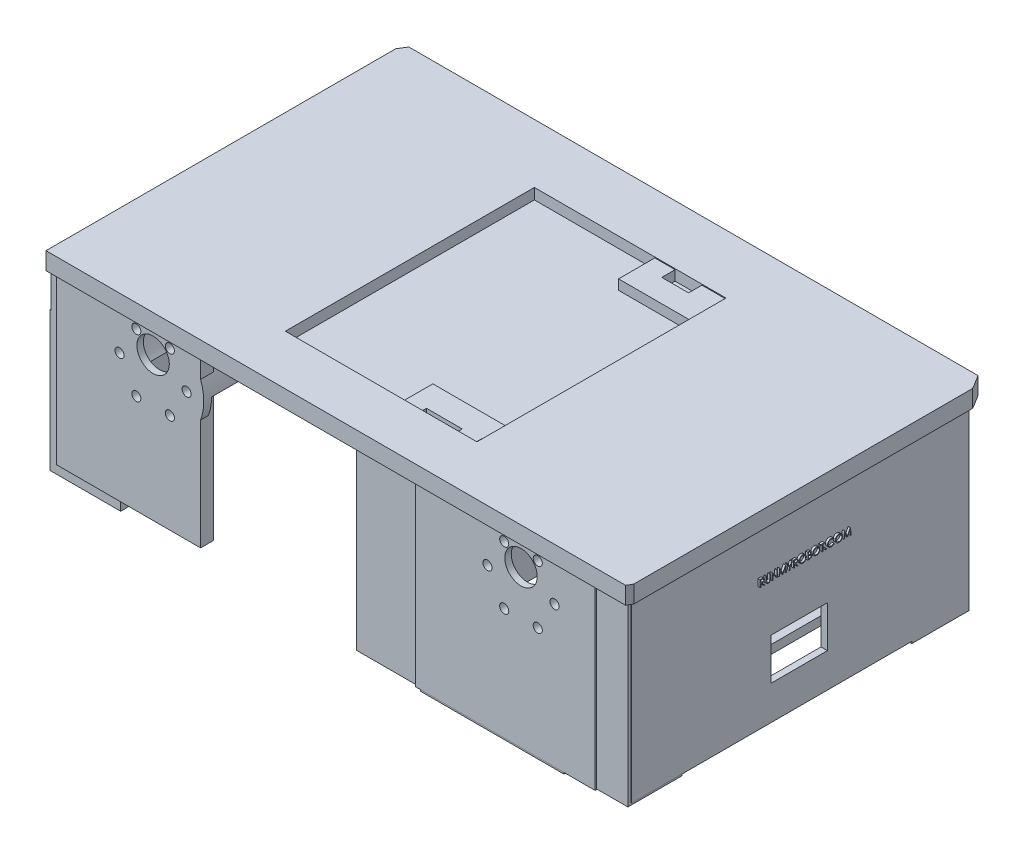
from build123d import *

# Parameters (mm, degrees)
MOTORHOLDERS_DEPTH            = 80
MOTORHOLDERS_DEPTH_BACK       = 80
MOTORHOLDERSSKETCH_R          = 23.41
MOTORHOLDERS_2_DEPTH          = 80
MOTORHOLDERS_2_DEPTH_BACK     = 80
SKETCH4_W                     = 262.774983374
SKETCH4_H                     = 153.112553215
CUT_EXTRUDE1_DEPTH            = 26
POWERBANKHOLDERS_DEPTH        = 30
POWERBANKHOLDERS_DEPTH_BACK   = 59
SKETCH6_W                     = 74.414236541
SKETCH6_H                     = 13.420779118
SKETCH6_W_2                   = 20.810206851
SKETCH6_H_2                   = 2.021058642
POWERBANKHOLDERS_2_DEPTH      = 30
POWERBANKHOLDERS_2_DEPTH_BACK = 59
SKETCH6_W_3                   = 32.64776113
SKETCH6_H_3                   = 26.17260787
SKETCH6_W_4                   = 10.842850571
SKETCH6_H_4                   = 10.347679347
POWERBANKHOLDERS_3_DEPTH      = 30
POWERBANKHOLDERS_3_DEPTH_BACK = 59
SKETCH6_W_5                   = 55.674763771
SKETCH6_H_5                   = 37.111507406
SKETCH6_W_6                   = 12.844328805
SKETCH6_H_6                   = 18.336479725
SKETCH6_W_7                   = 12.407504742
SKETCH6_H_7                   = 16.443461188
POWERBANKHOLDERS_4_DEPTH      = 30
POWERBANKHOLDERS_4_DEPTH_BACK = 59
SKETCH6_W_8                   = 56.474336521
SKETCH6_H_8                   = 35.272094794
SKETCH6_W_9                   = 11.134493861
SKETCH6_H_9                   = 18.035399163
SKETCH6_W_10                  = 16.537391536
SKETCH6_H_10                  = 14.436538778
POWERBANKHOLDERS_5_DEPTH      = 30
POWERBANKHOLDERS_5_DEPTH_BACK = 59
SKETCH6_W_11                  = 28.150495439
SKETCH6_H_11                  = 24.933985152
SKETCH6_W_12                  = 10.177859407
SKETCH6_H_12                  = 9.83070569
POWERBANKHOLDERS_6_DEPTH      = 30
POWERBANKHOLDERS_6_DEPTH_BACK = 59
SKETCH6_W_13                  = 30.670744753
SKETCH6_H_13                  = 26.330219561
SKETCH6_W_14                  = 9.898416255
SKETCH6_H_14                  = 10.635603546
POWERBANKCUT_DEPTH            = 64
BOTTOMPLATE_DEPTH             = 5
BOTTOMPLATE_DEPTH_BACK        = 3
SKETCH21_R                    = 156.395305675
SKETCH21_W                    = 88.537320887
SKETCH21_H                    = 115.069025425
SKETCH23_W                    = 66.548697278
SKETCH23_H                    = 81.163054316
SKETCH23_W_2                  = 82.936115801
SKETCH23_H_2                  = 87.063331284
MOTORMOUNTINGSUPPORT1_DEPTH   = 6
SKETCH24_W                    = 62.643465408
SKETCH24_H                    = 86.363062387
SKETCH24_W_2                  = 53.914675369
SKETCH24_H_2                  = 86.674739968
MOTORMOUNTINGSUPPOR2_DEPTH    = 6
SKETCH17_R                    = 2.1
SKETCH17_R_2                  = 7.5
MOTORHOLES1_DEPTH             = 31.5
SKETCH19_R                    = 2.1
SKETCH19_R_2                  = 7.5
CUT_EXTRUDE4_DEPTH            = 30
BOLTHOLESSKETCH3_R            = 2.1
BOLTHOLESSKETCH3_R_2          = 7.5
MOTORHOLES3_DEPTH             = 31.5
BOLTHOLESSKETCH4_R            = 2.1
BOLTHOLESSKETCH4_R_2          = 7.5
MOTORHOLES4_DEPTH             = 15
SKETCH29_W                    = 154.635205036
SKETCH29_H                    = 84.131588093
SKETCH29_W_2                  = 26
SKETCH29_H_2                  = 19.212652328
BOSS_EXTRUDE8_DEPTH           = 3
SKETCH27_W                    = 226.46009322
SKETCH27_H                    = 129.985211715
BOSS_EXTRUDE6_DEPTH           = 3
BOSS_EXTRUDE7_DEPTH           = 1.5
BOSS_EXTRUDE7_DEPTH_BACK      = 2.5
SKETCH28_W                    = 66.387115975
SKETCH28_H                    = 157.698901517
MOTORHOLDERCUT_DEPTH          = 77
MOTORHOLDERCUT_DEPTH_BACK     = 77
MOTORHOLDEREXTRUDESKETCH_R    = 20.415
BOSS_EXTRUDE9_DEPTH           = 1
CUT_EXTRUDE5_DEPTH            = 20
CUT_EXTRUDE5_DEPTH_BACK       = 20
SKETCH32_W                    = 420.045569038
SKETCH32_H                    = 425.046527557
SKETCH32_W_2                  = 269.205670794
SKETCH32_H_2                  = 165.352220901
SKETCH36_R                    = 7.458762178
CUT_EXTRUDE6_DEPTH            = 40
SKETCH37_W                    = 55.340133611
SKETCH37_H                    = 29.7708905
CUT_EXTRUDE7_DEPTH            = 36


with BuildPart() as part:
    # MotorHoldersSketch → MotorHolders (new, two sides: drawn at the far end of the back side and taken through both)
    with BuildSketch(Plane.XY.offset(-MOTORHOLDERS_DEPTH_BACK)):
        Circle(MOTORHOLDERSSKETCH_R)
    extrude(amount=MOTORHOLDERS_DEPTH + MOTORHOLDERS_DEPTH_BACK)


with BuildPart() as body_2:
    # MotorHoldersSketch → MotorHolders 2 (new, two sides: drawn at the far end of the back side and taken through both)
    with BuildSketch(Plane.XY.offset(-MOTORHOLDERS_2_DEPTH_BACK)):
        with Locations((170, 0)):
            Circle(MOTORHOLDERSSKETCH_R)
    extrude(amount=MOTORHOLDERS_2_DEPTH + MOTORHOLDERS_2_DEPTH_BACK)


with BuildPart() as cut_extrude1_tool:
    # Sketch4 → Cut-Extrude1 (new body)
    with BuildSketch(Plane(origin=(0, 0, 0), x_dir=(1, 0, 0), z_dir=(0, 1, 0))):
        with Locations((89.893628689, 0.176832173)):
            Rectangle(SKETCH4_W, SKETCH4_H)
    extrude(amount=-CUT_EXTRUDE1_DEPTH)


with BuildPart() as part_1:
    add(part.part)

    # Cut-Extrude1: cut by cut_extrude1_tool
    add(cut_extrude1_tool.part, mode=Mode.SUBTRACT)


with BuildPart() as body_2_1:
    add(body_2.part)

    # Cut-Extrude1: cut by cut_extrude1_tool
    add(cut_extrude1_tool.part, mode=Mode.SUBTRACT)


with BuildPart() as body_3:
    # Sketch6 → PowerBankHolders (new, two sides: drawn at the far end of the back side and taken through both)
    with BuildSketch(Plane(origin=(170, -34.829272125, 0), x_dir=(-1, 0, 0), z_dir=(0, -1, 0)).offset(-POWERBANKHOLDERS_DEPTH_BACK)):
        with Locations((182.378728269, 72.238602394)):
            Rectangle(SKETCH6_W, SKETCH6_H)
        with Locations((203.359863582, 72.025840015)):
            Rectangle(SKETCH6_W_2, SKETCH6_H_2, mode=Mode.SUBTRACT)
    extrude(amount=POWERBANKHOLDERS_DEPTH + POWERBANKHOLDERS_DEPTH_BACK)


with BuildPart() as body_4:
    # Sketch6 → PowerBankHolders 2 (new, two sides: drawn at the far end of the back side and taken through both)
    with BuildSketch(Plane(origin=(170, -34.829272125, 0), x_dir=(-1, 0, 0), z_dir=(0, -1, 0)).offset(-POWERBANKHOLDERS_2_DEPTH_BACK)):
        with Locations((202.990846936, -65.195848087)):
            Rectangle(SKETCH6_W_3, SKETCH6_H_3)
        with Locations((206.519672379, -65.314281269)):
            Rectangle(SKETCH6_W_4, SKETCH6_H_4, mode=Mode.SUBTRACT)
    extrude(amount=POWERBANKHOLDERS_2_DEPTH + POWERBANKHOLDERS_2_DEPTH_BACK)


with BuildPart() as body_5:
    # Sketch6 → PowerBankHolders 3 (new, two sides: drawn at the far end of the back side and taken through both)
    with BuildSketch(Plane(origin=(170, -34.829272125, 0), x_dir=(-1, 0, 0), z_dir=(0, -1, 0)).offset(-POWERBANKHOLDERS_3_DEPTH_BACK)):
        with Locations((47.827743092, 59.306920349)):
            Rectangle(SKETCH6_W_5, SKETCH6_H_5)
        with Locations((34.93306737, 60.00949088)):
            Rectangle(SKETCH6_W_6, SKETCH6_H_6, mode=Mode.SUBTRACT)
        with Locations((60.073413265, 59.541495334)):
            Rectangle(SKETCH6_W_7, SKETCH6_H_7, mode=Mode.SUBTRACT)
    extrude(amount=POWERBANKHOLDERS_3_DEPTH + POWERBANKHOLDERS_3_DEPTH_BACK)


with BuildPart() as body_6:
    # Sketch6 → PowerBankHolders 4 (new, two sides: drawn at the far end of the back side and taken through both)
    with BuildSketch(Plane(origin=(170, -34.829272125, 0), x_dir=(-1, 0, 0), z_dir=(0, -1, 0)).offset(-POWERBANKHOLDERS_4_DEPTH_BACK)):
        with Locations((48.322417758, -61.807610384)):
            Rectangle(SKETCH6_W_8, SKETCH6_H_8)
        with Locations((37.73953158, -63.792391966)):
            Rectangle(SKETCH6_W_9, SKETCH6_H_9, mode=Mode.SUBTRACT)
        with Locations((59.979410768, -62.645522509)):
            Rectangle(SKETCH6_W_10, SKETCH6_H_10, mode=Mode.SUBTRACT)
    extrude(amount=POWERBANKHOLDERS_4_DEPTH + POWERBANKHOLDERS_4_DEPTH_BACK)


with BuildPart() as body_7:
    # Sketch6 → PowerBankHolders 5 (new, two sides: drawn at the far end of the back side and taken through both)
    with BuildSketch(Plane(origin=(170, -34.829272125, 0), x_dir=(-1, 0, 0), z_dir=(0, -1, 0)).offset(-POWERBANKHOLDERS_5_DEPTH_BACK)):
        with Locations((-34.775388772, -66.976665205)):
            Rectangle(SKETCH6_W_11, SKETCH6_H_11)
        with Locations((-36.725173705, -67.894738702)):
            Rectangle(SKETCH6_W_12, SKETCH6_H_12, mode=Mode.SUBTRACT)
    extrude(amount=POWERBANKHOLDERS_5_DEPTH + POWERBANKHOLDERS_5_DEPTH_BACK)


with BuildPart() as body_8:
    # Sketch6 → PowerBankHolders 6 (new, two sides: drawn at the far end of the back side and taken through both)
    with BuildSketch(Plane(origin=(170, -34.829272125, 0), x_dir=(-1, 0, 0), z_dir=(0, -1, 0)).offset(-POWERBANKHOLDERS_6_DEPTH_BACK)):
        with Locations((-33.722690809, 64.697564271)):
            Rectangle(SKETCH6_W_13, SKETCH6_H_13)
        with Locations((-36.585452129, 63.859928969)):
            Rectangle(SKETCH6_W_14, SKETCH6_H_14, mode=Mode.SUBTRACT)
    extrude(amount=POWERBANKHOLDERS_6_DEPTH + POWERBANKHOLDERS_6_DEPTH_BACK)


with BuildPart() as powerbankcut_tool:
    # Sketch11 → PowerBankCut (new body)
    with BuildSketch(Plane(origin=(0, -20.425, 0), x_dir=(1, 0, 0), z_dir=(0, 1, 0))):
        Polygon((-18.932660375, -64.758061011), (-18.932660375, 72.241938989), (188.932660375, 63.758061011), (188.932660375, -71.241938989), align=None)
    extrude(amount=-POWERBANKCUT_DEPTH)


with BuildPart() as body_3_1:
    add(body_3.part)

    # PowerBankCut: cut by powerbankcut_tool
    add(powerbankcut_tool.part, mode=Mode.SUBTRACT)



with BuildPart() as body_4_1:
    add(body_4.part)

    # PowerBankCut: cut by powerbankcut_tool
    add(powerbankcut_tool.part, mode=Mode.SUBTRACT)


with BuildPart() as body_5_1:
    add(body_5.part)

    # PowerBankCut: cut by powerbankcut_tool
    add(powerbankcut_tool.part, mode=Mode.SUBTRACT)


with BuildPart() as body_6_1:
    add(body_6.part)

    # PowerBankCut: cut by powerbankcut_tool
    add(powerbankcut_tool.part, mode=Mode.SUBTRACT)


with BuildPart() as body_8_1:
    add(body_8.part)

    # PowerBankCut: cut by powerbankcut_tool
    add(powerbankcut_tool.part, mode=Mode.SUBTRACT)


with BuildPart() as body_3_2:
    add(body_3_1.part)

    add(body_4_1.part)  # BottomPlate merges body 4

    add(body_2_1.part)  # BottomPlate merges body 2

    add(part_1.part)  # BottomPlate merges part

    add(body_5_1.part)  # BottomPlate merges body 5

    add(body_6_1.part)  # BottomPlate merges body 6
    # Sketch21 → BottomPlate (add, two sides: drawn at the far end of the back side and taken through both)
    with BuildSketch(Plane(origin=(0, 19.575, 0), x_dir=(1, 0, 0), z_dir=(0, 1, 0)).offset(-BOTTOMPLATE_DEPTH_BACK)):
        with Locations((85, 0)):
            Circle(SKETCH21_R)
        with Locations((82.978570093, -0.057259585)):
            Rectangle(SKETCH21_W, SKETCH21_H, mode=Mode.SUBTRACT)
    extrude(amount=BOTTOMPLATE_DEPTH + BOTTOMPLATE_DEPTH_BACK)


    add(body_7.part)  # MotorMountingSupport1 merges body 7
    # Sketch23 → MotorMountingSupport1 (add)
    with BuildSketch(Plane.XY.offset(80)):
        with Locations((-11.315777772, -18.741332274)):
            Rectangle(SKETCH23_W, SKETCH23_H)
        with Locations((162.789906406, -21.691470758)):
            Rectangle(SKETCH23_W_2, SKETCH23_H_2)
    extrude(amount=-MOTORMOUNTINGSUPPORT1_DEPTH)


    add(body_8_1.part)  # MotorMountingSuppor2 merges body 8
    # Sketch24 → MotorMountingSuppor2 (add)
    with BuildSketch(Plane(origin=(0, 0, -80), x_dir=(-1, 0, 0), z_dir=(0, 0, -1))):
        with Locations((-170.868787608, -23.94412431)):
            Rectangle(SKETCH24_W, SKETCH24_H)
        with Locations((2.593149567, -20.814772641)):
            Rectangle(SKETCH24_W_2, SKETCH24_H_2)
    extrude(amount=-MOTORMOUNTINGSUPPOR2_DEPTH)

    # Sketch17 → MotorHoles1 (cut)
    with BuildSketch(Plane.XY.offset(80)):
        with Locations((185.5, 0)):
            Circle(SKETCH17_R)
        with Locations((177.75, -13.42)):
            Circle(SKETCH17_R)
        with Locations((162.25, -13.42)):
            Circle(SKETCH17_R)
        with Locations((154.5, 0)):
            Circle(SKETCH17_R)
        with Locations((162.25, 13.42)):
            Circle(SKETCH17_R)
        with Locations((177.75, 13.42)):
            Circle(SKETCH17_R)
        with Locations((170, 7)):
            Circle(SKETCH17_R_2)
    extrude(amount=-MOTORHOLES1_DEPTH, mode=Mode.SUBTRACT)

    # Sketch19 → Cut-Extrude4 (cut)
    with BuildSketch(Plane(origin=(0, 0, -80), x_dir=(-1, 0, 0), z_dir=(0, 0, -1))):
        with Locations((-185.5, 0)):
            Circle(SKETCH19_R)
        with Locations((-177.75, -13.42)):
            Circle(SKETCH19_R)
        with Locations((-162.25, -13.42)):
            Circle(SKETCH19_R)
        with Locations((-154.5, 0)):
            Circle(SKETCH19_R)
        with Locations((-162.25, 13.42)):
            Circle(SKETCH19_R)
        with Locations((-177.75, 13.42)):
            Circle(SKETCH19_R)
        with Locations((-170, 7)):
            Circle(SKETCH19_R_2)
    extrude(amount=-CUT_EXTRUDE4_DEPTH, mode=Mode.SUBTRACT)

    # BoltHolesSketch3 → MotorHoles3 (cut)
    with BuildSketch(Plane.XY.offset(80)):
        with Locations((7.75, -13.42)):
            Circle(BOLTHOLESSKETCH3_R)
        with Locations((15.5, 0)):
            Circle(BOLTHOLESSKETCH3_R)
        with Locations((7.75, 13.42)):
            Circle(BOLTHOLESSKETCH3_R)
        with Locations((-7.75, 13.42)):
            Circle(BOLTHOLESSKETCH3_R)
        with Locations((-15.5, 0)):
            Circle(BOLTHOLESSKETCH3_R)
        with Locations((-7.75, -13.42)):
            Circle(BOLTHOLESSKETCH3_R)
        with Locations((0, 7)):
            Circle(BOLTHOLESSKETCH3_R_2)
    extrude(amount=-MOTORHOLES3_DEPTH, mode=Mode.SUBTRACT)

    # BoltHolesSketch4 → MotorHoles4 (cut)
    with BuildSketch(Plane(origin=(0, 0, -80), x_dir=(-1, 0, 0), z_dir=(0, 0, -1))):
        with Locations((-15.5, 0)):
            Circle(BOLTHOLESSKETCH4_R)
        with Locations((-7.75, 13.42)):
            Circle(BOLTHOLESSKETCH4_R)
        with Locations((7.75, 13.42)):
            Circle(BOLTHOLESSKETCH4_R)
        with Locations((15.5, 0)):
            Circle(BOLTHOLESSKETCH4_R)
        with Locations((7.75, -13.42)):
            Circle(BOLTHOLESSKETCH4_R)
        with Locations((-7.75, -13.42)):
            Circle(BOLTHOLESSKETCH4_R)
        with Locations((0, 7)):
            Circle(BOLTHOLESSKETCH4_R_2)
    extrude(amount=-MOTORHOLES4_DEPTH, mode=Mode.SUBTRACT)

    # Sketch29 → Boss-Extrude8 (add)
    with BuildSketch(Plane(origin=(219.058063185, 0, 0), x_dir=(0, 0, -1), z_dir=(1, 0, 0))):
        with Locations((-0.622085312, -21.859578752)):
            Rectangle(SKETCH29_W, SKETCH29_H)
        with Locations((-0.45071267, -38.546737855)):
            Rectangle(SKETCH29_W_2, SKETCH29_H_2, mode=Mode.SUBTRACT)
    extrude(amount=-BOSS_EXTRUDE8_DEPTH)

    # Sketch27 → Boss-Extrude6 (add)
    with BuildSketch(Plane(origin=(0, 16.575, 0), x_dir=(-1, 0, 0), z_dir=(0, -1, 0))):
        with Locations((-81.596376522, -0.440920076)):
            Rectangle(SKETCH27_W, SKETCH27_H)
    extrude(amount=-BOSS_EXTRUDE6_DEPTH)

    # Sketch28 → Boss-Extrude7 (add, two sides: drawn at the far end of the back side and taken through both)
    with BuildSketch(Plane(origin=(0, -64.829272125, 0), x_dir=(-1, 0, 0), z_dir=(0, -1, 0)).offset(-BOSS_EXTRUDE7_DEPTH_BACK)):
        with Locations((-156.196154729, -0.699595313)):
            Rectangle(SKETCH28_W, SKETCH28_H)
    extrude(amount=BOSS_EXTRUDE7_DEPTH + BOSS_EXTRUDE7_DEPTH_BACK)

    # MotorHolderExtrudeSketch → MotorHolderCut (cut, two sides: drawn at the far end of the back side and taken through both)
    with BuildSketch(Plane.XY.offset(-MOTORHOLDERCUT_DEPTH_BACK)):
        with Locations((170, 0)):
            Circle(MOTORHOLDEREXTRUDESKETCH_R)
        Circle(MOTORHOLDEREXTRUDESKETCH_R)
    extrude(amount=MOTORHOLDERCUT_DEPTH + MOTORHOLDERCUT_DEPTH_BACK, mode=Mode.SUBTRACT)

    # Sketch31 → Boss-Extrude9 (add)
    # profile 1 of 14: a face of its own
    with BuildSketch(Plane(origin=(219.058063185, 0, 0), x_dir=(0, 0, -1), z_dir=(1, 0, 0))):
        with BuildLine():
            Line((-19.523067462, -3.211949724), (-18.887685851, -3.211949724))
            add(Edge.make_bspline(
                [(-18.887685851, -3.211949724), (-18.84528497, -3.212090863), (-18.763870582, -3.212361865), (-18.647236258, -3.21387295), (-18.541257392, -3.218203972), (-18.445989395, -3.221931045), (-18.361434015, -3.228727306), (-18.287331972, -3.235223036), (-18.224024561, -3.243726285), (-18.185701539, -3.251623347), (-18.168349914, -3.255198923)],
                knots=[0, 0, 0, 0, 1.410062039, 2.707475311, 3.878576406, 4.937260626, 5.877586885, 6.699081471, 7.410979367, 8, 8, 8, 8], degree=3))
            add(Edge.make_bspline(
                [(-18.168349914, -3.255198923), (-18.145121047, -3.260938203), (-18.09915885, -3.272294329), (-18.032982719, -3.296296966), (-17.969923296, -3.32407334), (-17.910242527, -3.356697572), (-17.854239345, -3.394411837), (-17.801336306, -3.436565062), (-17.75129335, -3.482926599), (-17.7061343, -3.534665348), (-17.663553874, -3.58894561), (-17.627641334, -3.647641161), (-17.596683742, -3.709019832), (-17.572036202, -3.773705847), (-17.552189754, -3.841071883), (-17.538195951, -3.911728148), (-17.529803803, -3.985352747), (-17.528949405, -4.035570279), (-17.52851618, -4.061033258)],
                knots=[0, 0, 0, 0, 1.027469482, 2.033020251, 3.019912614, 3.986113645, 4.951240523, 5.91722682, 6.890402269, 7.87763091, 8.8651537, 9.85103654, 10.82876324, 11.815024772, 12.821070561, 13.842952187, 14.906261191, 16, 16, 16, 16], degree=3))
            add(Edge.make_bspline(
                [(-17.52851618, -4.061033258), (-17.529848771, -4.10333796), (-17.532449001, -4.185885391), (-17.556692488, -4.305683476), (-17.596404045, -4.417433783), (-17.651125886, -4.520995604), (-17.720812125, -4.614350261), (-17.8045639, -4.696347317), (-17.902427933, -4.764963524), (-17.993531669, -4.812545711), (-18.074008122, -4.843019278), (-18.14025977, -4.864460832), (-18.2125291, -4.881027043), (-18.290123682, -4.89586802), (-18.373366426, -4.907072771), (-18.462057819, -4.915279325), (-18.556261114, -4.920408355), (-18.620975841, -4.921172174), (-18.654267382, -4.921565109)],
                knots=[0, 0, 0, 0, 1.260483769, 2.459530307, 3.627416485, 4.787058657, 5.939039949, 7.08810263, 8.267026773, 9.491475466, 10.141966685, 10.831826277, 11.566392101, 12.351337768, 13.187381173, 14.07005841, 15.007169909, 16, 16, 16, 16], degree=3))
            Line((-18.654267382, -4.921565109), (-17.487811051, -6.386949724))
            Line((-17.487811051, -6.386949724), (-17.840164818, -6.386949724))
            Line((-17.840164818, -6.386949724), (-19.006621148, -4.921565109))
            Line((-19.006621148, -4.921565109), (-19.238131564, -4.921565109))
            Line((-19.238131564, -4.921565109), (-19.238131564, -6.386949724))
            Line((-19.238131564, -6.386949724), (-19.523067462, -6.386949724))
            Line((-19.523067462, -6.386949724), (-19.523067462, -3.211949724))
        make_face()
        with BuildLine():
            Line((-19.238131564, -3.53759075), (-19.238131564, -4.595924083))
            Line((-19.238131564, -4.595924083), (-18.656811452, -4.600376207))
            add(Edge.make_bspline(
                [(-18.656811452, -4.600376207), (-18.629669703, -4.600388214), (-18.577061261, -4.600411488), (-18.500951373, -4.596788563), (-18.430085271, -4.592667124), (-18.364734018, -4.586363075), (-18.304868417, -4.578238638), (-18.250518392, -4.568075931), (-18.201595224, -4.556235846), (-18.144537264, -4.537910085), (-18.080822696, -4.508876054), (-18.011579158, -4.466634495), (-17.952612751, -4.413503937), (-17.902794405, -4.352749444), (-17.862762706, -4.285950847), (-17.834539628, -4.213908855), (-17.816630413, -4.138442191), (-17.814518089, -4.086573479), (-17.813452077, -4.06039724)],
                knots=[0, 0, 0, 0, 1.146690395, 2.22261258, 3.21895312, 4.145990853, 4.996080663, 5.770904154, 6.481378293, 7.121626537, 8.300444488, 9.431385265, 10.535395872, 11.636531494, 12.74115979, 13.810798291, 14.895190096, 16, 16, 16, 16], degree=3))
            add(Edge.make_bspline(
                [(-17.813452077, -4.06039724), (-17.814542573, -4.034864277), (-17.816703537, -3.98426726), (-17.834346348, -3.910193685), (-17.864181716, -3.840282951), (-17.904388317, -3.774819454), (-17.953373265, -3.715396394), (-18.010811567, -3.664553619), (-18.075132708, -3.622598748), (-18.135250152, -3.595788703), (-18.188984045, -3.579351407), (-18.235638094, -3.56778428), (-18.288353506, -3.558491083), (-18.347386243, -3.551045199), (-18.412484294, -3.544645357), (-18.483976813, -3.540334815), (-18.561389464, -3.537782238), (-18.61504418, -3.537656065), (-18.642819064, -3.53759075)],
                knots=[0, 0, 0, 0, 1.101028733, 2.181837193, 3.264309656, 4.369019818, 5.486613113, 6.575447106, 7.666700264, 8.788928104, 9.402425223, 10.0903467, 10.862060571, 11.710948788, 12.657782767, 13.684531032, 14.801375019, 16, 16, 16, 16], degree=3))
            Line((-18.642819064, -3.53759075), (-19.238131564, -3.53759075))
        make_face(mode=Mode.SUBTRACT)
    # profile 2 of 14: a face of its own
    with BuildSketch(Plane(origin=(219.058063185, 0, 0), x_dir=(0, 0, -1), z_dir=(1, 0, 0))):
        with BuildLine():
            Line((-16.836529, -3.211949724), (-16.551593103, -3.211949724))
            Line((-16.551593103, -3.211949724), (-16.551593103, -5.11427845))
            add(Edge.make_bspline(
                [(-16.551593103, -5.11427845), (-16.551635506, -5.141203118), (-16.551715974, -5.192297314), (-16.551178479, -5.265021415), (-16.549673195, -5.329675717), (-16.548724179, -5.38650944), (-16.546612955, -5.435261789), (-16.544891155, -5.476196892), (-16.542677222, -5.509120919), (-16.540016465, -5.528335045), (-16.53887275, -5.536594155)],
                knots=[0, 0, 0, 0, 1.528628734, 2.90083645, 4.128790002, 5.200304208, 6.127813768, 6.898992206, 7.526736466, 8, 8, 8, 8], degree=3))
            add(Edge.make_bspline(
                [(-16.53887275, -5.536594155), (-16.534176055, -5.566390862), (-16.525047308, -5.624305338), (-16.501782379, -5.706772136), (-16.469290789, -5.781095673), (-16.430788886, -5.849595202), (-16.380050017, -5.910364121), (-16.319268239, -5.966345406), (-16.245628406, -6.015305543), (-16.163749142, -6.06007378), (-16.075497534, -6.096055676), (-15.985317314, -6.123263942), (-15.89456404, -6.139845516), (-15.83380709, -6.141765519), (-15.803636372, -6.142718955)],
                knots=[0, 0, 0, 0, 1.035780045, 2.013197591, 2.933192213, 3.817615948, 4.702609284, 5.640816605, 6.646850145, 7.73207398, 8.84249596, 9.914020372, 10.964143139, 12, 12, 12, 12], degree=3))
            add(Edge.make_bspline(
                [(-15.803636372, -6.142718955), (-15.77773405, -6.141744819), (-15.726079012, -6.139802174), (-15.649328893, -6.127772162), (-15.574580223, -6.106090935), (-15.501463892, -6.078114868), (-15.432928356, -6.041150982), (-15.368935376, -5.998451006), (-15.311818093, -5.948366854), (-15.259695481, -5.892940113), (-15.214306646, -5.830401866), (-15.174962825, -5.762113841), (-15.142735732, -5.687048362), (-15.126821248, -5.634293993), (-15.118645386, -5.607192112)],
                knots=[0, 0, 0, 0, 0.994687771, 1.983630487, 2.973142513, 3.978332533, 4.983357753, 5.956394766, 6.925816176, 7.893390482, 8.871859704, 9.88551698, 10.913711441, 12, 12, 12, 12], degree=3))
            add(Edge.make_bspline(
                [(-15.118645386, -5.607192112), (-15.115923844, -5.595990191), (-15.109859151, -5.571027797), (-15.104192189, -5.52882634), (-15.098289841, -5.479033846), (-15.094194481, -5.421292558), (-15.090201945, -5.355795962), (-15.087813372, -5.282202857), (-15.08670935, -5.200780471), (-15.086380347, -5.143959617), (-15.086208487, -5.11427845)],
                knots=[0, 0, 0, 0, 0.558680831, 1.244966039, 2.062412453, 2.990489873, 4.051219941, 5.244515665, 6.560634259, 8, 8, 8, 8], degree=3))
            Line((-15.086208487, -5.11427845), (-15.086208487, -3.211949724))
            Line((-15.086208487, -3.211949724), (-14.80127259, -3.211949724))
            Line((-14.80127259, -3.211949724), (-14.80127259, -5.129542873))
            add(Edge.make_bspline(
                [(-14.80127259, -5.129542873), (-14.801503113, -5.164103546), (-14.801952994, -5.231550799), (-14.805854231, -5.330385246), (-14.81207451, -5.424141165), (-14.82086299, -5.512831158), (-14.832507985, -5.59613786), (-14.84545765, -5.674791471), (-14.861949083, -5.7482274), (-14.881210811, -5.817018236), (-14.903230387, -5.882500809), (-14.931752, -5.944647909), (-14.963887082, -6.005348829), (-15.002000375, -6.06368547), (-15.044827843, -6.119916129), (-15.093316154, -6.17369979), (-15.145861642, -6.225895925), (-15.203337814, -6.275165635), (-15.264797219, -6.320349221), (-15.330057038, -6.360080056), (-15.398615965, -6.393665766), (-15.470295786, -6.421311783), (-15.545127092, -6.442098598), (-15.623111768, -6.457588204), (-15.704427322, -6.466389574), (-15.759730975, -6.46769761), (-15.787735931, -6.468359981)],
                knots=[0, 0, 0, 0, 1.316592851, 2.569410997, 3.76748051, 4.895814652, 5.963796859, 6.97159953, 7.931736103, 8.829262218, 9.692595152, 10.560224239, 11.431080259, 12.30701507, 13.211635791, 14.121146779, 15.063487852, 16.031507147, 17.00238618, 17.966455255, 18.938106653, 19.907068911, 20.888905087, 21.893141452, 22.933117798, 24, 24, 24, 24], degree=3))
            add(Edge.make_bspline(
                [(-15.787735931, -6.468359981), (-15.818278617, -6.467648086), (-15.878203258, -6.466251353), (-15.96650279, -6.458247858), (-16.051152097, -6.4431726), (-16.133045214, -6.423977508), (-16.211067208, -6.397503689), (-16.286263404, -6.366571819), (-16.357345922, -6.328583161), (-16.425467931, -6.286316298), (-16.48880896, -6.238759662), (-16.546954461, -6.186925361), (-16.60000043, -6.131643733), (-16.647052747, -6.072316258), (-16.688890978, -6.009404353), (-16.724931957, -5.942730042), (-16.755877543, -5.872319141), (-16.771849215, -5.823375881), (-16.779923431, -5.798633418)],
                knots=[0, 0, 0, 0, 1.13879206, 2.234305948, 3.301075583, 4.341971843, 5.366689343, 6.369221514, 7.369726634, 8.367512178, 9.355451585, 10.318319045, 11.268648973, 12.207971039, 13.137398894, 14.081662264, 15.030215811, 16, 16, 16, 16], degree=3))
            add(Edge.make_bspline(
                [(-16.779923431, -5.798633418), (-16.784619853, -5.781731011), (-16.794806497, -5.745069314), (-16.80571516, -5.684393714), (-16.814885541, -5.614530182), (-16.823508441, -5.535473935), (-16.828596567, -5.447163699), (-16.833057386, -5.349637754), (-16.836560426, -5.242778174), (-16.836539768, -5.168343007), (-16.836529, -5.129542873)],
                knots=[0, 0, 0, 0, 0.625038921, 1.35572334, 2.194682327, 3.136881307, 4.189498639, 5.346923369, 6.617055217, 8, 8, 8, 8], degree=3))
            Line((-16.836529, -5.129542873), (-16.836529, -3.211949724))
        make_face()
    # profile 3 of 14: a face of its own
    with BuildSketch(Plane(origin=(219.058063185, 0, 0), x_dir=(0, 0, -1), z_dir=(1, 0, 0))):
        Polygon((-13.987170026, -6.386949724), (-13.987170026, -3.211949724), (-13.927384369, -3.211949724), (-11.829798231, -5.710862985), (-11.829798231, -3.211949724), (-11.544862334, -3.211949724), (-11.544862334, -6.386949724), (-11.609736132, -6.386949724), (-13.702234128, -3.893760622), (-13.702234128, -6.386949724), align=None)
    # profile 4 of 14: a face of its own
    with BuildSketch(Plane(origin=(219.058063185, 0, 0), x_dir=(0, 0, -1), z_dir=(1, 0, 0))):
        Polygon((-10.893580282, -6.386949724), (-10.474444665, -3.211949724), (-10.433739537, -3.211949724), (-9.122907205, -5.817077929), (-7.815254962, -3.211949724), (-7.773913816, -3.211949724), (-7.352234128, -6.386949724), (-7.638442061, -6.386949724), (-7.942458487, -4.102374404), (-9.088562253, -6.386949724), (-9.152800034, -6.386949724), (-10.303355923, -4.097286263), (-10.606736332, -6.386949724), align=None)
    # profile 5 of 14: a face of its own
    with BuildSketch(Plane(origin=(219.058063185, 0, 0), x_dir=(0, 0, -1), z_dir=(1, 0, 0))):
        Polygon((-6.945182846, -3.211949724), (-6.618905803, -3.211949724), (-5.784450675, -4.576207537), (-4.951267582, -3.211949724), (-4.624990539, -3.211949724), (-5.642618744, -4.877679892), (-5.642618744, -6.386949724), (-5.927554641, -6.386949724), (-5.927554641, -4.877679892), align=None)
    # profile 6 of 14: a face of its own
    with BuildSketch(Plane(origin=(219.058063185, 0, 0), x_dir=(0, 0, -1), z_dir=(1, 0, 0))):
        with BuildLine():
            Line((-4.055118744, -3.211949724), (-3.419737133, -3.211949724))
            add(Edge.make_bspline(
                [(-3.419737133, -3.211949724), (-3.377336252, -3.212090863), (-3.295921864, -3.212361865), (-3.17928754, -3.21387295), (-3.073308674, -3.218203972), (-2.978040677, -3.221931045), (-2.893485297, -3.228727306), (-2.819383255, -3.235223036), (-2.756075843, -3.243726285), (-2.717752821, -3.251623347), (-2.700401196, -3.255198923)],
                knots=[0, 0, 0, 0, 1.410062039, 2.707475311, 3.878576406, 4.937260626, 5.877586885, 6.699081471, 7.410979367, 8, 8, 8, 8], degree=3))
            add(Edge.make_bspline(
                [(-2.700401196, -3.255198923), (-2.67717233, -3.260938203), (-2.631210132, -3.272294329), (-2.565034001, -3.296296966), (-2.501974578, -3.32407334), (-2.442293809, -3.356697572), (-2.386290627, -3.394411837), (-2.333387588, -3.436565062), (-2.283344632, -3.482926599), (-2.238185582, -3.534665348), (-2.195605156, -3.58894561), (-2.159692616, -3.647641161), (-2.128735024, -3.709019832), (-2.104087484, -3.773705847), (-2.084241036, -3.841071883), (-2.070247233, -3.911728148), (-2.061855085, -3.985352747), (-2.061000687, -4.035570279), (-2.060567462, -4.061033258)],
                knots=[0, 0, 0, 0, 1.027469482, 2.033020251, 3.019912614, 3.986113645, 4.951240523, 5.91722682, 6.890402269, 7.87763091, 8.8651537, 9.85103654, 10.82876324, 11.815024772, 12.821070561, 13.842952187, 14.906261191, 16, 16, 16, 16], degree=3))
            add(Edge.make_bspline(
                [(-2.060567462, -4.061033258), (-2.061900053, -4.10333796), (-2.064500283, -4.185885391), (-2.08874377, -4.305683476), (-2.128455327, -4.417433783), (-2.183177168, -4.520995604), (-2.252863407, -4.614350261), (-2.336615182, -4.696347317), (-2.434479215, -4.764963524), (-2.525582952, -4.812545711), (-2.606059404, -4.843019278), (-2.672311052, -4.864460832), (-2.744580382, -4.881027043), (-2.822174964, -4.89586802), (-2.905417708, -4.907072771), (-2.994109101, -4.915279325), (-3.088312396, -4.920408355), (-3.153027123, -4.921172174), (-3.186318664, -4.921565109)],
                knots=[0, 0, 0, 0, 1.260483769, 2.459530307, 3.627416485, 4.787058657, 5.939039949, 7.08810263, 8.267026773, 9.491475466, 10.141966685, 10.831826277, 11.566392101, 12.351337768, 13.187381173, 14.07005841, 15.007169909, 16, 16, 16, 16], degree=3))
            Line((-3.186318664, -4.921565109), (-2.019862334, -6.386949724))
            Line((-2.019862334, -6.386949724), (-2.3722161, -6.386949724))
            Line((-2.3722161, -6.386949724), (-3.53867243, -4.921565109))
            Line((-3.53867243, -4.921565109), (-3.770182846, -4.921565109))
            Line((-3.770182846, -4.921565109), (-3.770182846, -6.386949724))
            Line((-3.770182846, -6.386949724), (-4.055118744, -6.386949724))
            Line((-4.055118744, -6.386949724), (-4.055118744, -3.211949724))
        make_face()
        with BuildLine():
            Line((-3.770182846, -3.53759075), (-3.770182846, -4.595924083))
            Line((-3.770182846, -4.595924083), (-3.188862734, -4.600376207))
            add(Edge.make_bspline(
                [(-3.188862734, -4.600376207), (-3.161720985, -4.600388214), (-3.109112543, -4.600411488), (-3.033002655, -4.596788563), (-2.962136553, -4.592667124), (-2.8967853, -4.586363075), (-2.836919699, -4.578238638), (-2.782569674, -4.568075931), (-2.733646506, -4.556235846), (-2.676588546, -4.537910085), (-2.612873978, -4.508876054), (-2.54363044, -4.466634495), (-2.484664033, -4.413503937), (-2.434845687, -4.352749444), (-2.394813988, -4.285950847), (-2.36659091, -4.213908855), (-2.348681695, -4.138442191), (-2.346569371, -4.086573479), (-2.345503359, -4.06039724)],
                knots=[0, 0, 0, 0, 1.146690395, 2.22261258, 3.21895312, 4.145990853, 4.996080663, 5.770904154, 6.481378293, 7.121626537, 8.300444488, 9.431385265, 10.535395872, 11.636531494, 12.74115979, 13.810798291, 14.895190096, 16, 16, 16, 16], degree=3))
            add(Edge.make_bspline(
                [(-2.345503359, -4.06039724), (-2.346593855, -4.034864277), (-2.348754819, -3.98426726), (-2.36639763, -3.910193685), (-2.396232998, -3.840282951), (-2.436439599, -3.774819454), (-2.485424547, -3.715396394), (-2.542862849, -3.664553619), (-2.60718399, -3.622598748), (-2.667301434, -3.595788703), (-2.721035327, -3.579351407), (-2.767689376, -3.56778428), (-2.820404788, -3.558491083), (-2.879437525, -3.551045199), (-2.944535576, -3.544645357), (-3.016028095, -3.540334815), (-3.093440746, -3.537782238), (-3.147095462, -3.537656065), (-3.174870346, -3.53759075)],
                knots=[0, 0, 0, 0, 1.101028733, 2.181837193, 3.264309656, 4.369019818, 5.486613113, 6.575447106, 7.666700264, 8.788928104, 9.402425223, 10.0903467, 10.862060571, 11.710948788, 12.657782767, 13.684531032, 14.801375019, 16, 16, 16, 16], degree=3))
            Line((-3.174870346, -3.53759075), (-3.770182846, -3.53759075))
        make_face(mode=Mode.SUBTRACT)
    # profile 7 of 14: a face of its own
    with BuildSketch(Plane(origin=(219.058063185, 0, 0), x_dir=(0, 0, -1), z_dir=(1, 0, 0))):
        with BuildLine():
            add(Edge.make_bspline(
                [(0.117156897, -3.130539468), (0.175947108, -3.132028524), (0.291415931, -3.134953153), (0.461119588, -3.157340626), (0.623130853, -3.196071444), (0.778769479, -3.247654292), (0.926173822, -3.316465056), (1.066453389, -3.399636584), (1.19927441, -3.498040228), (1.322846664, -3.610915313), (1.435928326, -3.733727446), (1.535556094, -3.86478955), (1.619051603, -4.003309178), (1.68761871, -4.148870074), (1.74141102, -4.301143045), (1.778530439, -4.460939891), (1.802241475, -4.627225245), (1.805013501, -4.740642472), (1.806419718, -4.798177689)],
                knots=[0, 0, 0, 0, 1.065120563, 2.091984664, 3.0946048, 4.079830382, 5.057816894, 6.036188127, 7.030412546, 8.04752943, 9.064399622, 10.05169764, 11.02544977, 11.989514704, 12.962713494, 13.945757189, 14.957906945, 16, 16, 16, 16], degree=3))
            add(Edge.make_bspline(
                [(1.806419718, -4.798177689), (1.805013708, -4.855289087), (1.802242299, -4.967862268), (1.778503479, -5.133092392), (1.741273429, -5.291924667), (1.688118245, -5.444093938), (1.619877989, -5.589760728), (1.535826512, -5.72854175), (1.436819843, -5.860482502), (1.324146485, -5.984137563), (1.201318397, -6.097528126), (1.069573798, -6.196333106), (0.931875572, -6.281354276), (0.786451765, -6.349193752), (0.635231017, -6.403415422), (0.47685991, -6.44038388), (0.312080536, -6.464229983), (0.19971184, -6.466968208), (0.142597602, -6.468359981)],
                knots=[0, 0, 0, 0, 1.043624062, 2.057103931, 3.04512605, 4.022047818, 4.998200453, 5.980619268, 6.982898556, 8.009068085, 9.034988726, 10.034168286, 11.015286542, 11.987931943, 12.962482838, 13.94673481, 14.956375938, 16, 16, 16, 16], degree=3))
            add(Edge.make_bspline(
                [(0.142597602, -6.468359981), (0.085062684, -6.466954465), (-0.028353954, -6.464183821), (-0.194848265, -6.440433546), (-0.354757361, -6.403293935), (-0.507623951, -6.350217518), (-0.65353328, -6.281621887), (-0.792770712, -6.197979343), (-0.924777367, -6.098731437), (-1.048458809, -5.986094615), (-1.161624153, -5.863474708), (-1.260284444, -5.732089348), (-1.343945796, -5.594516183), (-1.412311105, -5.450373429), (-1.466435293, -5.300357906), (-1.503360378, -5.14346893), (-1.527250849, -4.98060095), (-1.530003889, -4.869709178), (-1.531400795, -4.813442112)],
                knots=[0, 0, 0, 0, 1.053102029, 2.075944431, 3.073151272, 4.055350789, 5.033113405, 6.020478099, 7.024410459, 8.052272461, 9.079885166, 10.07527673, 11.055994387, 12.023226415, 12.992069828, 13.970394897, 14.97016774, 16, 16, 16, 16], degree=3))
            add(Edge.make_bspline(
                [(-1.531400795, -4.813442112), (-1.530915804, -4.775675334), (-1.529951941, -4.700618222), (-1.518348049, -4.589160663), (-1.501509934, -4.479495566), (-1.477378199, -4.371934778), (-1.445817187, -4.266741599), (-1.408577133, -4.16319055), (-1.363093131, -4.062331029), (-1.311675686, -3.963685238), (-1.254288189, -3.868790923), (-1.190900902, -3.779093015), (-1.123740246, -3.693838826), (-1.050113453, -3.615237615), (-0.972447106, -3.541002798), (-0.889481292, -3.47227519), (-0.801722256, -3.408435056), (-0.708792383, -3.350903747), (-0.612981519, -3.298870818), (-0.514214728, -3.254219567), (-0.41383341, -3.215896354), (-0.311367407, -3.184835034), (-0.207088821, -3.160313116), (-0.10077006, -3.143615016), (0.007504177, -3.131981528), (0.080448731, -3.131022223), (0.117156897, -3.130539468)],
                knots=[0, 0, 0, 0, 1.037015668, 2.060948919, 3.074880161, 4.083647147, 5.086022904, 6.090072063, 7.104153813, 8.122640571, 9.144368836, 10.147691507, 11.138137339, 12.123020368, 13.103399296, 14.087645067, 15.080126199, 16.082011238, 17.087798457, 18.072939717, 19.057185487, 20.037253025, 21.01195951, 21.997135196, 22.992090687, 24, 24, 24, 24], degree=3))
        make_face()
        with BuildLine():
            add(Edge.make_bspline(
                [(0.131149285, -3.456180493), (0.101018867, -3.456547787), (0.041046081, -3.457278862), (-0.048112034, -3.466908833), (-0.136097574, -3.480633803), (-0.22292871, -3.500211326), (-0.308242129, -3.526885002), (-0.392833057, -3.55758354), (-0.475930113, -3.594976958), (-0.557258969, -3.637225054), (-0.636103359, -3.68398729), (-0.710500595, -3.735668821), (-0.780643279, -3.791057652), (-0.846359671, -3.850283048), (-0.907456806, -3.913646615), (-0.965137214, -3.980187754), (-1.017088906, -4.051808398), (-1.064700822, -4.12656641), (-1.107307363, -4.204364415), (-1.145194506, -4.284383362), (-1.176186142, -4.367275978), (-1.201461298, -4.452142964), (-1.222416126, -4.538849909), (-1.235691186, -4.628054572), (-1.245426969, -4.719308709), (-1.246116258, -4.780977963), (-1.246464898, -4.812170077)],
                knots=[0, 0, 0, 0, 1.008559885, 2.007477868, 2.99961109, 3.989939068, 4.984837346, 5.991145699, 7.001802488, 8.033829008, 9.059044045, 10.069351652, 11.065060232, 12.050310815, 13.029377138, 14.011219647, 14.996725999, 15.989392538, 16.977580475, 17.965360261, 18.951710183, 19.937753436, 20.929683414, 21.935841486, 22.955955122, 24, 24, 24, 24], degree=3))
            add(Edge.make_bspline(
                [(-1.246464898, -4.812170077), (-1.245308416, -4.858037234), (-1.243033258, -4.948272122), (-1.223114605, -5.080504653), (-1.192433243, -5.207584741), (-1.147205489, -5.328817045), (-1.090644574, -5.445243644), (-1.020770181, -5.55583171), (-0.937985153, -5.660611132), (-0.843947525, -5.758850412), (-0.741147642, -5.848517677), (-0.631988665, -5.927224484), (-0.517640035, -5.993818067), (-0.397803559, -6.048069812), (-0.273119005, -6.091059074), (-0.142782941, -6.120521832), (-0.007663596, -6.139912424), (0.084439213, -6.141774567), (0.131149285, -6.142718955)],
                knots=[0, 0, 0, 0, 1.032063989, 2.030389145, 3.003944642, 3.970395727, 4.937377036, 5.913328081, 6.909231446, 7.93887556, 8.970685674, 9.976071282, 10.964166581, 11.944589148, 12.933237628, 13.927779006, 14.949070134, 16, 16, 16, 16], degree=3))
            add(Edge.make_bspline(
                [(0.131149285, -6.142718955), (0.162545047, -6.142287605), (0.224812273, -6.141432107), (0.317427497, -6.13281545), (0.408374203, -6.118997969), (0.497524829, -6.099103731), (0.584778193, -6.074205194), (0.670498479, -6.044625326), (0.753772642, -6.007721663), (0.835651209, -5.96694745), (0.914024943, -5.920465307), (0.988842033, -5.870537843), (1.058216672, -5.815230594), (1.123883901, -5.75688515), (1.185231876, -5.694325088), (1.24184574, -5.627631744), (1.29353486, -5.556384147), (1.341128697, -5.481739529), (1.383585942, -5.403728643), (1.420578411, -5.323419578), (1.45196203, -5.241010086), (1.477297174, -5.156381303), (1.497150414, -5.069693962), (1.510830055, -4.980831991), (1.520398996, -4.889973159), (1.521120245, -4.828519804), (1.52148382, -4.797541671)],
                knots=[0, 0, 0, 0, 1.047197238, 2.076906641, 3.100256066, 4.114471768, 5.12198147, 6.126382909, 7.136867548, 8.15857795, 9.17633901, 10.174870724, 11.156907918, 12.133735059, 13.104061851, 14.077631395, 15.04955518, 16.038496417, 17.029181396, 18.010275684, 18.986308667, 19.968651475, 20.955262928, 21.950658345, 22.966943676, 24, 24, 24, 24], degree=3))
            add(Edge.make_bspline(
                [(1.52148382, -4.797541671), (1.521119954, -4.766775464), (1.520398157, -4.705745024), (1.510834626, -4.615519853), (1.497135961, -4.527297297), (1.477394076, -4.441423704), (1.45194858, -4.357877185), (1.42057293, -4.276736207), (1.383574837, -4.197698487), (1.34111309, -4.120959375), (1.293383022, -4.047322291), (1.24122753, -3.976925817), (1.183746107, -3.911091973), (1.12258107, -3.8481955), (1.056204624, -3.789577843), (0.984917443, -3.735219557), (0.909584964, -3.683808801), (0.8298224, -3.637430613), (0.747504671, -3.594600559), (0.663037009, -3.55790572), (0.577376326, -3.526725298), (0.490740452, -3.500130622), (0.402400179, -3.48071048), (0.31295242, -3.466896464), (0.222520928, -3.457282214), (0.161703151, -3.456548899), (0.131149285, -3.456180493)],
                knots=[0, 0, 0, 0, 1.02996197, 2.043119294, 3.035359645, 4.018872909, 4.991431989, 5.957985074, 6.929999688, 7.912076566, 8.892894881, 9.867085534, 10.843653904, 11.817741046, 12.803660682, 13.806313499, 14.818574707, 15.856120519, 16.894564902, 17.924820532, 18.937903209, 19.946497019, 20.957711757, 21.963978472, 22.977135795, 24, 24, 24, 24], degree=3))
        make_face(mode=Mode.SUBTRACT)
    # profile 8 of 14: a face of its own
    with BuildSketch(Plane(origin=(219.058063185, 0, 0), x_dir=(0, 0, -1), z_dir=(1, 0, 0))):
        with BuildLine():
            Line((2.457701769, -3.211949724), (3.077182939, -3.211949724))
            add(Edge.make_bspline(
                [(3.077182939, -3.211949724), (3.107507344, -3.212109155), (3.166283588, -3.212418171), (3.251754082, -3.217210726), (3.33180836, -3.223745484), (3.40646964, -3.234114211), (3.47570342, -3.246625323), (3.539718348, -3.261776256), (3.598310861, -3.279943255), (3.668263129, -3.308832382), (3.748019729, -3.351761256), (3.834378271, -3.415196455), (3.908223545, -3.492786617), (3.971892561, -3.580310169), (4.022512148, -3.676590476), (4.059132868, -3.779332741), (4.082317512, -3.887211749), (4.084701877, -3.961273775), (4.085906897, -3.99870353)],
                knots=[0, 0, 0, 0, 1.001505555, 1.941167018, 2.826882275, 3.653841531, 4.429895133, 5.150066043, 5.825578002, 6.45369114, 7.647487171, 8.808567382, 9.977351308, 11.170798116, 12.373658725, 13.556498008, 14.765093433, 16, 16, 16, 16], degree=3))
            add(Edge.make_bspline(
                [(4.085906897, -3.99870353), (4.084915192, -4.03376692), (4.082966397, -4.102669788), (4.06433118, -4.203448015), (4.035156859, -4.299379478), (3.994602812, -4.390114071), (3.941896001, -4.473601705), (3.879431669, -4.550515868), (3.804069141, -4.617600041), (3.747605631, -4.65510396), (3.718924726, -4.674154251)],
                knots=[0, 0, 0, 0, 1.044552857, 2.05264487, 3.044412934, 4.028983338, 5.005914585, 5.980388656, 6.974128949, 8, 8, 8, 8], degree=3))
            add(Edge.make_bspline(
                [(3.718924726, -4.674154251), (3.754993114, -4.688001786), (3.824000874, -4.71449555), (3.918966043, -4.761336293), (4.000785652, -4.81228335), (4.070088778, -4.8679201), (4.129359365, -4.927890235), (4.181114533, -4.993073089), (4.225275494, -5.064318962), (4.263115074, -5.140885026), (4.292641446, -5.221989466), (4.314753874, -5.306871527), (4.327424345, -5.395226838), (4.32922742, -5.455357146), (4.330137666, -5.485712745)],
                knots=[0, 0, 0, 0, 1.27268992, 2.434971085, 3.483601985, 4.442670788, 5.356604649, 6.2567628, 7.179492994, 8.113709626, 9.066344395, 10.018646069, 10.999752585, 12, 12, 12, 12], degree=3))
            add(Edge.make_bspline(
                [(4.330137666, -5.485712745), (4.329251528, -5.516706979), (4.327508024, -5.577689003), (4.314644764, -5.667274018), (4.292865074, -5.752885576), (4.26286482, -5.835077421), (4.223710435, -5.913690543), (4.176060067, -5.988814004), (4.119244292, -6.059693003), (4.055687261, -6.127115147), (3.983785171, -6.187737497), (3.906210165, -6.241726745), (3.821985289, -6.286127816), (3.732493838, -6.323425921), (3.636731922, -6.351916737), (3.535129557, -6.371849001), (3.427774369, -6.385279284), (3.354105523, -6.386383463), (3.316325567, -6.386949724)],
                knots=[0, 0, 0, 0, 0.978564426, 1.925352924, 2.850884081, 3.763762016, 4.682927383, 5.618979971, 6.567305752, 7.547517671, 8.540179244, 9.531824382, 10.526200242, 11.540722885, 12.589160233, 13.674978461, 14.80764778, 16, 16, 16, 16], degree=3))
            Line((3.316325567, -6.386949724), (2.457701769, -6.386949724))
            Line((2.457701769, -6.386949724), (2.457701769, -3.211949724))
        make_face()
        with BuildLine():
            Line((2.742637666, -3.53759075), (2.742637666, -4.555218955))
            Line((2.742637666, -4.555218955), (2.934078973, -4.555218955))
            add(Edge.make_bspline(
                [(2.934078973, -4.555218955), (2.962063237, -4.554856168), (3.016134539, -4.554155189), (3.094439016, -4.552147212), (3.167123854, -4.546524702), (3.234063588, -4.540903807), (3.295152805, -4.531764717), (3.350256165, -4.520886148), (3.400238464, -4.509380941), (3.457877909, -4.489814335), (3.523258369, -4.46089673), (3.592956971, -4.416018707), (3.654401811, -4.362565901), (3.706287832, -4.300888386), (3.748752523, -4.23297406), (3.778247107, -4.159906533), (3.798247144, -4.083506841), (3.800053747, -4.031057426), (3.800971, -4.004427689)],
                knots=[0, 0, 0, 0, 1.156816544, 2.235205308, 3.236616184, 4.169592532, 5.011045266, 5.787822928, 6.49130361, 7.128639758, 8.301311294, 9.436451833, 10.541879658, 11.654887649, 12.756523258, 13.837046038, 14.901820046, 16, 16, 16, 16], degree=3))
            add(Edge.make_bspline(
                [(3.800971, -4.004427689), (3.800493679, -3.986805739), (3.799557363, -3.95223836), (3.79188901, -3.90184716), (3.778855567, -3.854454613), (3.762114887, -3.809411242), (3.738720862, -3.768125492), (3.711176863, -3.729169879), (3.677897701, -3.693871028), (3.640017853, -3.660878698), (3.596467174, -3.631628305), (3.547271645, -3.606009898), (3.491765681, -3.585380765), (3.430884734, -3.56731397), (3.363691676, -3.554624589), (3.290961902, -3.544053301), (3.212099693, -3.538671457), (3.157539493, -3.53795902), (3.129336384, -3.53759075)],
                knots=[0, 0, 0, 0, 0.91205012, 1.789085906, 2.630437955, 3.453916878, 4.269457761, 5.079663411, 5.91843418, 6.774407191, 7.675494373, 8.627863946, 9.638891023, 10.736472738, 11.911756761, 13.175263542, 14.539845004, 16, 16, 16, 16], degree=3))
            Line((3.129336384, -3.53759075), (2.742637666, -3.53759075))
        make_face(mode=Mode.SUBTRACT)
        with BuildLine():
            Line((2.742637666, -4.880859981), (2.742637666, -6.061308699))
            Line((2.742637666, -6.061308699), (3.148416913, -6.061308699))
            add(Edge.make_bspline(
                [(3.148416913, -6.061308699), (3.177462653, -6.060960585), (3.233444488, -6.060289642), (3.314272032, -6.058099296), (3.389186705, -6.053117017), (3.457846657, -6.045273996), (3.520993282, -6.036766403), (3.577869055, -6.02532617), (3.628935023, -6.012218898), (3.688148145, -5.991958613), (3.754826328, -5.960483958), (3.82668189, -5.913027481), (3.890568531, -5.856491337), (3.944820445, -5.791058294), (3.989282227, -5.719909876), (4.021626819, -5.644485166), (4.041575667, -5.566030437), (4.043990635, -5.512539205), (4.045201769, -5.485712745)],
                knots=[0, 0, 0, 0, 1.160039823, 2.235823828, 3.228722157, 4.157150951, 4.99529583, 5.772374946, 6.472645482, 7.099169577, 8.269452708, 9.405989375, 10.527446681, 11.663510218, 12.788923519, 13.866172445, 14.929861265, 16, 16, 16, 16], degree=3))
            add(Edge.make_bspline(
                [(4.045201769, -5.485712745), (4.044951303, -5.468936643), (4.044454411, -5.43565504), (4.036960853, -5.38674569), (4.026062557, -5.339369362), (4.011973328, -5.293397411), (3.99145424, -5.249660991), (3.967499731, -5.207295098), (3.939413316, -5.166243727), (3.895648966, -5.11434404), (3.831992951, -5.054547893), (3.741544662, -4.996003159), (3.638699792, -4.948788362), (3.564107709, -4.92874098), (3.525575367, -4.918385021)],
                knots=[0, 0, 0, 0, 0.723448775, 1.435228256, 2.130040452, 2.821711965, 3.505591119, 4.210454504, 4.921174351, 5.648778258, 7.137944449, 8.670945889, 10.280296675, 12, 12, 12, 12], degree=3))
            add(Edge.make_bspline(
                [(3.525575367, -4.918385021), (3.510127544, -4.915250766), (3.476633478, -4.908455055), (3.422016602, -4.901281639), (3.359663349, -4.894890763), (3.289429739, -4.890163498), (3.211226912, -4.885277134), (3.12488785, -4.883376832), (3.030765143, -4.881109646), (2.965457777, -4.880945331), (2.931534902, -4.880859981)],
                knots=[0, 0, 0, 0, 0.634451884, 1.375622551, 2.216452059, 3.157844607, 4.20941857, 5.370758133, 6.634282058, 8, 8, 8, 8], degree=3))
            Line((2.931534902, -4.880859981), (2.742637666, -4.880859981))
        make_face(mode=Mode.SUBTRACT)
    # profile 9 of 14: a face of its own
    with BuildSketch(Plane(origin=(219.058063185, 0, 0), x_dir=(0, 0, -1), z_dir=(1, 0, 0))):
        with BuildLine():
            add(Edge.make_bspline(
                [(6.467156897, -3.130539468), (6.525947108, -3.132028524), (6.641415931, -3.134953153), (6.811119588, -3.157340626), (6.973130853, -3.196071444), (7.128769479, -3.247654292), (7.276173822, -3.316465056), (7.416453389, -3.399636584), (7.54927441, -3.498040228), (7.672846664, -3.610915313), (7.785928326, -3.733727446), (7.885556094, -3.86478955), (7.969051603, -4.003309178), (8.03761871, -4.148870074), (8.09141102, -4.301143045), (8.128530439, -4.460939891), (8.152241475, -4.627225245), (8.155013501, -4.740642472), (8.156419718, -4.798177689)],
                knots=[0, 0, 0, 0, 1.065120563, 2.091984664, 3.0946048, 4.079830382, 5.057816894, 6.036188127, 7.030412546, 8.04752943, 9.064399622, 10.05169764, 11.02544977, 11.989514704, 12.962713494, 13.945757189, 14.957906945, 16, 16, 16, 16], degree=3))
            add(Edge.make_bspline(
                [(8.156419718, -4.798177689), (8.155013708, -4.855289087), (8.152242299, -4.967862268), (8.128503479, -5.133092392), (8.091273429, -5.291924667), (8.038118245, -5.444093938), (7.969877989, -5.589760728), (7.885826512, -5.72854175), (7.786819843, -5.860482502), (7.674146485, -5.984137563), (7.551318397, -6.097528126), (7.419573798, -6.196333106), (7.281875572, -6.281354276), (7.136451765, -6.349193752), (6.985231017, -6.403415422), (6.82685991, -6.44038388), (6.662080536, -6.464229983), (6.54971184, -6.466968208), (6.492597602, -6.468359981)],
                knots=[0, 0, 0, 0, 1.043624062, 2.057103931, 3.04512605, 4.022047818, 4.998200453, 5.980619268, 6.982898556, 8.009068085, 9.034988726, 10.034168286, 11.015286542, 11.987931943, 12.962482838, 13.94673481, 14.956375938, 16, 16, 16, 16], degree=3))
            add(Edge.make_bspline(
                [(6.492597602, -6.468359981), (6.435062684, -6.466954465), (6.321646046, -6.464183821), (6.155151735, -6.440433546), (5.995242639, -6.403293935), (5.842376049, -6.350217518), (5.69646672, -6.281621887), (5.557229288, -6.197979343), (5.425222633, -6.098731437), (5.301541191, -5.986094615), (5.188375847, -5.863474708), (5.089715556, -5.732089348), (5.006054204, -5.594516183), (4.937688895, -5.450373429), (4.883564707, -5.300357906), (4.846639622, -5.14346893), (4.822749151, -4.98060095), (4.819996111, -4.869709178), (4.818599205, -4.813442112)],
                knots=[0, 0, 0, 0, 1.053102029, 2.075944431, 3.073151272, 4.055350789, 5.033113405, 6.020478099, 7.024410459, 8.052272461, 9.079885166, 10.07527673, 11.055994387, 12.023226415, 12.992069828, 13.970394897, 14.97016774, 16, 16, 16, 16], degree=3))
            add(Edge.make_bspline(
                [(4.818599205, -4.813442112), (4.819084196, -4.775675334), (4.820048059, -4.700618222), (4.831651951, -4.589160663), (4.848490066, -4.479495566), (4.872621801, -4.371934778), (4.904182813, -4.266741599), (4.941422867, -4.16319055), (4.986906869, -4.062331029), (5.038324314, -3.963685238), (5.095711811, -3.868790923), (5.159099098, -3.779093015), (5.226259754, -3.693838826), (5.299886547, -3.615237615), (5.377552894, -3.541002798), (5.460518708, -3.47227519), (5.548277744, -3.408435056), (5.641207617, -3.350903747), (5.737018481, -3.298870818), (5.835785272, -3.254219567), (5.93616659, -3.215896354), (6.038632593, -3.184835034), (6.142911179, -3.160313116), (6.24922994, -3.143615016), (6.357504177, -3.131981528), (6.430448731, -3.131022223), (6.467156897, -3.130539468)],
                knots=[0, 0, 0, 0, 1.037015668, 2.060948919, 3.074880161, 4.083647147, 5.086022904, 6.090072063, 7.104153813, 8.122640571, 9.144368836, 10.147691507, 11.138137339, 12.123020368, 13.103399296, 14.087645067, 15.080126199, 16.082011238, 17.087798457, 18.072939717, 19.057185487, 20.037253025, 21.01195951, 21.997135196, 22.992090687, 24, 24, 24, 24], degree=3))
        make_face()
        with BuildLine():
            add(Edge.make_bspline(
                [(6.481149285, -3.456180493), (6.451018867, -3.456547787), (6.391046081, -3.457278862), (6.301887966, -3.466908833), (6.213902426, -3.480633803), (6.12707129, -3.500211326), (6.041757871, -3.526885002), (5.957166943, -3.55758354), (5.874069887, -3.594976958), (5.792741031, -3.637225054), (5.713896641, -3.68398729), (5.639499405, -3.735668821), (5.569356721, -3.791057652), (5.503640329, -3.850283048), (5.442543194, -3.913646615), (5.384862786, -3.980187754), (5.332911094, -4.051808398), (5.285299178, -4.12656641), (5.242692637, -4.204364415), (5.204805494, -4.284383362), (5.173813858, -4.367275978), (5.148538702, -4.452142964), (5.127583874, -4.538849909), (5.114308814, -4.628054572), (5.104573031, -4.719308709), (5.103883742, -4.780977963), (5.103535102, -4.812170077)],
                knots=[0, 0, 0, 0, 1.008559885, 2.007477868, 2.99961109, 3.989939068, 4.984837346, 5.991145699, 7.001802488, 8.033829008, 9.059044045, 10.069351652, 11.065060232, 12.050310815, 13.029377138, 14.011219647, 14.996725999, 15.989392538, 16.977580475, 17.965360261, 18.951710183, 19.937753436, 20.929683414, 21.935841486, 22.955955122, 24, 24, 24, 24], degree=3))
            add(Edge.make_bspline(
                [(5.103535102, -4.812170077), (5.104691584, -4.858037234), (5.106966742, -4.948272122), (5.126885395, -5.080504653), (5.157566757, -5.207584741), (5.202794511, -5.328817045), (5.259355426, -5.445243644), (5.329229819, -5.55583171), (5.412014847, -5.660611132), (5.506052475, -5.758850412), (5.608852358, -5.848517677), (5.718011335, -5.927224484), (5.832359965, -5.993818067), (5.952196441, -6.048069812), (6.076880995, -6.091059074), (6.207217059, -6.120521832), (6.342336404, -6.139912424), (6.434439213, -6.141774567), (6.481149285, -6.142718955)],
                knots=[0, 0, 0, 0, 1.032063989, 2.030389145, 3.003944642, 3.970395727, 4.937377036, 5.913328081, 6.909231446, 7.93887556, 8.970685674, 9.976071282, 10.964166581, 11.944589148, 12.933237628, 13.927779006, 14.949070134, 16, 16, 16, 16], degree=3))
            add(Edge.make_bspline(
                [(6.481149285, -6.142718955), (6.512545047, -6.142287605), (6.574812273, -6.141432107), (6.667427497, -6.13281545), (6.758374203, -6.118997969), (6.847524829, -6.099103731), (6.934778193, -6.074205194), (7.020498479, -6.044625326), (7.103772642, -6.007721663), (7.185651209, -5.96694745), (7.264024943, -5.920465307), (7.338842033, -5.870537843), (7.408216672, -5.815230594), (7.473883901, -5.75688515), (7.535231876, -5.694325088), (7.59184574, -5.627631744), (7.64353486, -5.556384147), (7.691128697, -5.481739529), (7.733585942, -5.403728643), (7.770578411, -5.323419578), (7.80196203, -5.241010086), (7.827297174, -5.156381303), (7.847150414, -5.069693962), (7.860830055, -4.980831991), (7.870398996, -4.889973159), (7.871120245, -4.828519804), (7.87148382, -4.797541671)],
                knots=[0, 0, 0, 0, 1.047197238, 2.076906641, 3.100256066, 4.114471768, 5.12198147, 6.126382909, 7.136867548, 8.15857795, 9.17633901, 10.174870724, 11.156907918, 12.133735059, 13.104061851, 14.077631395, 15.04955518, 16.038496417, 17.029181396, 18.010275684, 18.986308667, 19.968651475, 20.955262928, 21.950658345, 22.966943676, 24, 24, 24, 24], degree=3))
            add(Edge.make_bspline(
                [(7.87148382, -4.797541671), (7.871119954, -4.766775464), (7.870398157, -4.705745024), (7.860834626, -4.615519853), (7.847135961, -4.527297297), (7.827394076, -4.441423704), (7.80194858, -4.357877185), (7.77057293, -4.276736207), (7.733574837, -4.197698487), (7.69111309, -4.120959375), (7.643383022, -4.047322291), (7.59122753, -3.976925817), (7.533746107, -3.911091973), (7.47258107, -3.8481955), (7.406204624, -3.789577843), (7.334917443, -3.735219557), (7.259584964, -3.683808801), (7.1798224, -3.637430613), (7.097504671, -3.594600559), (7.013037009, -3.55790572), (6.927376326, -3.526725298), (6.840740452, -3.500130622), (6.752400179, -3.48071048), (6.66295242, -3.466896464), (6.572520928, -3.457282214), (6.511703151, -3.456548899), (6.481149285, -3.456180493)],
                knots=[0, 0, 0, 0, 1.02996197, 2.043119294, 3.035359645, 4.018872909, 4.991431989, 5.957985074, 6.929999688, 7.912076566, 8.892894881, 9.867085534, 10.843653904, 11.817741046, 12.803660682, 13.806313499, 14.818574707, 15.856120519, 16.894564902, 17.924820532, 18.937903209, 19.946497019, 20.957711757, 21.963978472, 22.977135795, 24, 24, 24, 24], degree=3))
        make_face(mode=Mode.SUBTRACT)
    # profile 10 of 14: a face of its own
    with BuildSketch(Plane(origin=(219.058063185, 0, 0), x_dir=(0, 0, -1), z_dir=(1, 0, 0))):
        Polygon((8.441355615, -3.53759075), (8.441355615, -3.211949724), (10.110265872, -3.211949724), (10.110265872, -3.53759075), (9.418278692, -3.53759075), (9.418278692, -6.386949724), (9.133342795, -6.386949724), (9.133342795, -3.53759075), align=None)
    # profile 11 of 14: a face of its own
    with BuildSketch(Plane(origin=(219.058063185, 0, 0), x_dir=(0, 0, -1), z_dir=(1, 0, 0))):
        with BuildLine():
            add(Edge.make_bspline(
                [(10.822605615, -5.898488186), (10.840286022, -5.899538808), (10.874946392, -5.901598431), (10.925056173, -5.9157287), (10.970408472, -5.940819056), (11.010805579, -5.974258862), (11.044103597, -6.014804213), (11.070088117, -6.059794788), (11.084095296, -6.11032409), (11.086139916, -6.145185295), (11.087188949, -6.163071519)],
                knots=[0, 0, 0, 0, 1.020151414, 1.999887582, 2.974338812, 3.990962822, 5.007586832, 5.987933904, 6.967670073, 8, 8, 8, 8], degree=3))
            add(Edge.make_bspline(
                [(11.087188949, -6.163071519), (11.086104368, -6.180527968), (11.083965591, -6.21495183), (11.070120225, -6.265100014), (11.043905565, -6.310118705), (11.01103525, -6.351214216), (10.970398485, -6.384724863), (10.924948953, -6.409601755), (10.875064026, -6.424743765), (10.840305647, -6.42667262), (10.822605615, -6.427654852)],
                knots=[0, 0, 0, 0, 1.009421747, 1.99056486, 2.972319754, 3.999869655, 5.017953583, 5.993804169, 6.978383603, 8, 8, 8, 8], degree=3))
            add(Edge.make_bspline(
                [(10.822605615, -6.427654852), (10.804892829, -6.426708161), (10.770312832, -6.42485997), (10.720614108, -6.409290853), (10.674887787, -6.384958143), (10.634258934, -6.351151732), (10.60111332, -6.310330174), (10.576053152, -6.264789973), (10.561003517, -6.215095383), (10.559024246, -6.180556243), (10.558022282, -6.163071519)],
                knots=[0, 0, 0, 0, 1.022052826, 1.995314843, 2.982371812, 4.00089066, 5.028879526, 6.005146991, 6.990147033, 8, 8, 8, 8], degree=3))
            add(Edge.make_bspline(
                [(10.558022282, -6.163071519), (10.558985758, -6.14515601), (10.560866826, -6.110178178), (10.576084746, -6.060104702), (10.600918881, -6.014594761), (10.634488061, -5.97432072), (10.674877958, -5.940586524), (10.720503801, -5.916034891), (10.770432527, -5.901483945), (10.804912971, -5.899504091), (10.822605615, -5.898488186)],
                knots=[0, 0, 0, 0, 1.032775665, 2.016367738, 2.991239715, 4.008302682, 5.025365648, 6.011011707, 6.979408107, 8, 8, 8, 8], degree=3))
        make_face()
    # profile 12 of 14: a face of its own
    with BuildSketch(Plane(origin=(219.058063185, 0, 0), x_dir=(0, 0, -1), z_dir=(1, 0, 0))):
        with BuildLine():
            Line((14.709945359, -3.794541872), (14.460626449, -3.98534716))
            add(Edge.make_bspline(
                [(14.460626449, -3.98534716), (14.442841107, -3.964150887), (14.407510209, -3.922044114), (14.350669361, -3.862916956), (14.291431442, -3.80752204), (14.229819096, -3.755595478), (14.164723323, -3.708953126), (14.097721028, -3.66516434), (14.027691372, -3.62591432), (13.930852299, -3.578322897), (13.804171751, -3.528660314), (13.644700718, -3.487019525), (13.478229936, -3.460511745), (13.364657828, -3.457640781), (13.306890471, -3.456180493)],
                knots=[0, 0, 0, 0, 0.757959112, 1.505699292, 2.245454638, 2.979532153, 3.711538275, 4.438200793, 5.171680507, 5.909471876, 7.393775596, 8.890124382, 10.418191784, 12, 12, 12, 12], degree=3))
            add(Edge.make_bspline(
                [(13.306890471, -3.456180493), (13.275064907, -3.456546945), (13.211709149, -3.457276448), (13.117685177, -3.46690044), (13.025416909, -3.480427037), (12.934964364, -3.500497866), (12.846442681, -3.525873028), (12.759273144, -3.556194653), (12.674717815, -3.593709401), (12.591606984, -3.635173322), (12.5119787, -3.68200679), (12.436635907, -3.733091045), (12.365853393, -3.78785444), (12.299575166, -3.846502229), (12.23773347, -3.908770293), (12.18077641, -3.975322232), (12.128901073, -4.045945275), (12.081079201, -4.119708152), (12.038250507, -4.196396006), (12.002391259, -4.276292677), (11.970636612, -4.35802997), (11.945509442, -4.44253138), (11.925620773, -4.529202318), (11.911897822, -4.61827539), (11.90238328, -4.709564513), (11.901657405, -4.771440104), (11.901291513, -4.802629812)],
                knots=[0, 0, 0, 0, 1.054917814, 2.100044995, 3.131103042, 4.146048494, 5.169673617, 6.183595914, 7.203665975, 8.234915748, 9.262203917, 10.264457458, 11.251630812, 12.227803204, 13.197192746, 14.159520551, 15.12972552, 16.100847026, 17.073214652, 18.039054194, 19.002613845, 19.979014051, 20.95965708, 21.949030935, 22.966165397, 24, 24, 24, 24], degree=3))
            add(Edge.make_bspline(
                [(11.901291513, -4.802629812), (11.902436163, -4.84955751), (11.904683531, -4.941693819), (11.92468452, -5.076650016), (11.955078424, -5.205936627), (12.000631126, -5.328745484), (12.056800551, -5.446590923), (12.127775963, -5.557479026), (12.209978107, -5.66308548), (12.304569902, -5.76091444), (12.408352321, -5.850280462), (12.519702212, -5.928975633), (12.638342245, -5.994575562), (12.762962473, -6.049163742), (12.894521877, -6.091125202), (13.032783876, -6.120665514), (13.177447757, -6.139935206), (13.27629857, -6.141780052), (13.326607017, -6.142718955)],
                knots=[0, 0, 0, 0, 1.029171465, 2.020641659, 2.987623507, 3.938342917, 4.889210282, 5.84687017, 6.821220943, 7.821438502, 8.827599549, 9.822697543, 10.807740252, 11.797342354, 12.80366471, 13.83203677, 14.896651826, 16, 16, 16, 16], degree=3))
            add(Edge.make_bspline(
                [(13.326607017, -6.142718955), (13.382035885, -6.14118699), (13.491133157, -6.138171718), (13.651124152, -6.112627256), (13.804282311, -6.071209002), (13.950615872, -6.013244458), (14.089712301, -5.937892376), (14.221789271, -5.846545016), (14.346958267, -5.738333457), (14.422225073, -5.655708047), (14.460626449, -5.613552288)],
                knots=[0, 0, 0, 0, 1.028121516, 2.023589091, 2.998037872, 3.967518031, 4.937445131, 5.927275754, 6.942489185, 8, 8, 8, 8], degree=3))
            Line((14.460626449, -5.613552288), (14.709945359, -5.802449524))
            add(Edge.make_bspline(
                [(14.709945359, -5.802449524), (14.689881073, -5.828337977), (14.649848609, -5.879990878), (14.58502598, -5.952808786), (14.516738717, -6.021301733), (14.444479609, -6.084917503), (14.369079898, -6.144929054), (14.289185729, -6.19963143), (14.205847392, -6.249788161), (14.119347258, -6.295714014), (14.02977723, -6.336460373), (13.937244636, -6.371343434), (13.842148328, -6.401392441), (13.74448396, -6.426113841), (13.644048952, -6.445409753), (13.541205736, -6.458309029), (13.435732349, -6.467146337), (13.364574774, -6.467951804), (13.32851507, -6.468359981)],
                knots=[0, 0, 0, 0, 0.986787822, 1.968848986, 2.935600012, 3.899624008, 4.868462664, 5.837806735, 6.815139263, 7.798259679, 8.787526145, 9.778297419, 10.776456485, 11.791383307, 12.812564526, 13.85620153, 14.913611965, 16, 16, 16, 16], degree=3))
            add(Edge.make_bspline(
                [(13.32851507, -6.468359981), (13.294366887, -6.468122316), (13.226843082, -6.467652363), (13.127149215, -6.460039469), (13.03009438, -6.449652922), (12.93595597, -6.43401366), (12.844220264, -6.415558437), (12.755718877, -6.390819512), (12.669580936, -6.363107053), (12.586152512, -6.330536101), (12.505362642, -6.293782135), (12.427471899, -6.25224265), (12.352516106, -6.206266958), (12.279758332, -6.156868485), (12.210273381, -6.102460504), (12.143459112, -6.043798628), (12.078940865, -5.981080575), (12.039024144, -5.935855101), (12.018954774, -5.913116591)],
                knots=[0, 0, 0, 0, 1.114604814, 2.203992996, 3.262667896, 4.300477797, 5.318619304, 6.316056647, 7.298880507, 8.271930387, 9.238335007, 10.195173496, 11.151986948, 12.108099108, 13.064862484, 14.031167946, 15.010108607, 16, 16, 16, 16], degree=3))
            add(Edge.make_bspline(
                [(12.018954774, -5.913116591), (11.986809583, -5.873618513), (11.922907286, -5.795099211), (11.841150416, -5.667839785), (11.771166562, -5.534972196), (11.714582691, -5.395798403), (11.670347926, -5.250630702), (11.639703556, -5.099395914), (11.619790315, -4.942235281), (11.617513125, -4.835340479), (11.616355615, -4.781005213)],
                knots=[0, 0, 0, 0, 0.994628077, 1.977248131, 2.950237994, 3.925870899, 4.908910175, 5.911660606, 6.938484602, 8, 8, 8, 8], degree=3))
            add(Edge.make_bspline(
                [(11.616355615, -4.781005213), (11.617766398, -4.723895623), (11.620542025, -4.61153607), (11.644123925, -4.446641127), (11.682059547, -4.288660929), (11.735941011, -4.137890389), (11.804253722, -3.993536492), (11.88864215, -3.856701971), (11.988125915, -3.726511731), (12.10192478, -3.604941207), (12.226718006, -3.493780508), (12.360357215, -3.395984881), (12.502580839, -3.314598277), (12.651822033, -3.246566044), (12.80919833, -3.194274281), (12.974373957, -3.157668176), (13.147038544, -3.134883363), (13.264842316, -3.132002996), (13.324698965, -3.130539468)],
                knots=[0, 0, 0, 0, 1.032925535, 2.032216505, 3.007276963, 3.968222605, 4.92396291, 5.891752235, 6.871517503, 7.883894988, 8.900124299, 9.891468569, 10.874487609, 11.85992873, 12.854644235, 13.869047385, 14.917252991, 16, 16, 16, 16], degree=3))
            add(Edge.make_bspline(
                [(13.324698965, -3.130539468), (13.361179236, -3.130976836), (13.433388258, -3.131842562), (13.540206736, -3.140284563), (13.644203704, -3.15435762), (13.745450809, -3.173512912), (13.844440611, -3.197286696), (13.940416543, -3.228256824), (14.033941781, -3.263668534), (14.124426476, -3.304452286), (14.211436489, -3.35023283), (14.294944721, -3.400502717), (14.374287843, -3.455199626), (14.450024156, -3.513858364), (14.520886718, -3.577719914), (14.588887488, -3.645027733), (14.651717181, -3.717720559), (14.690500436, -3.768887892), (14.709945359, -3.794541872)],
                knots=[0, 0, 0, 0, 1.096760587, 2.17092713, 3.219439832, 4.250915756, 5.268269357, 6.278326846, 7.281116186, 8.274029601, 9.260640565, 10.235837813, 11.203064059, 12.156899882, 13.114053108, 14.069676657, 15.032185724, 16, 16, 16, 16], degree=3))
        make_face()
    # profile 13 of 14: a face of its own
    with BuildSketch(Plane(origin=(219.058063185, 0, 0), x_dir=(0, 0, -1), z_dir=(1, 0, 0))):
        with BuildLine():
            add(Edge.make_bspline(
                [(16.84696459, -3.130539468), (16.9057548, -3.132028524), (17.021223624, -3.134953153), (17.190927281, -3.157340626), (17.352938546, -3.196071444), (17.508577172, -3.247654292), (17.655981515, -3.316465056), (17.796261081, -3.399636584), (17.929082103, -3.498040228), (18.052654356, -3.610915313), (18.165736018, -3.733727446), (18.265363786, -3.86478955), (18.348859296, -4.003309178), (18.417426402, -4.148870074), (18.471218713, -4.301143045), (18.508338131, -4.460939891), (18.532049167, -4.627225245), (18.534821194, -4.740642472), (18.53622741, -4.798177689)],
                knots=[0, 0, 0, 0, 1.065120563, 2.091984664, 3.0946048, 4.079830382, 5.057816894, 6.036188127, 7.030412546, 8.04752943, 9.064399622, 10.05169764, 11.02544977, 11.989514704, 12.962713494, 13.945757189, 14.957906945, 16, 16, 16, 16], degree=3))
            add(Edge.make_bspline(
                [(18.53622741, -4.798177689), (18.5348214, -4.855289087), (18.532049991, -4.967862268), (18.508311171, -5.133092392), (18.471081121, -5.291924667), (18.417925937, -5.444093938), (18.349685681, -5.589760728), (18.265634205, -5.72854175), (18.166627535, -5.860482502), (18.053954177, -5.984137563), (17.931126089, -6.097528126), (17.79938149, -6.196333106), (17.661683264, -6.281354276), (17.516259457, -6.349193752), (17.36503871, -6.403415422), (17.206667602, -6.44038388), (17.041888228, -6.464229983), (16.929519532, -6.466968208), (16.872405295, -6.468359981)],
                knots=[0, 0, 0, 0, 1.043624062, 2.057103931, 3.04512605, 4.022047818, 4.998200453, 5.980619268, 6.982898556, 8.009068085, 9.034988726, 10.034168286, 11.015286542, 11.987931943, 12.962482838, 13.94673481, 14.956375938, 16, 16, 16, 16], degree=3))
            add(Edge.make_bspline(
                [(16.872405295, -6.468359981), (16.814870377, -6.466954465), (16.701453738, -6.464183821), (16.534959427, -6.440433546), (16.375050331, -6.403293935), (16.222183741, -6.350217518), (16.076274412, -6.281621887), (15.93703698, -6.197979343), (15.805030325, -6.098731437), (15.681348883, -5.986094615), (15.568183539, -5.863474708), (15.469523249, -5.732089348), (15.385861896, -5.594516183), (15.317496587, -5.450373429), (15.263372399, -5.300357906), (15.226447314, -5.14346893), (15.202556843, -4.98060095), (15.199803804, -4.869709178), (15.198406897, -4.813442112)],
                knots=[0, 0, 0, 0, 1.053102029, 2.075944431, 3.073151272, 4.055350789, 5.033113405, 6.020478099, 7.024410459, 8.052272461, 9.079885166, 10.07527673, 11.055994387, 12.023226415, 12.992069828, 13.970394897, 14.97016774, 16, 16, 16, 16], degree=3))
            add(Edge.make_bspline(
                [(15.198406897, -4.813442112), (15.198891888, -4.775675334), (15.199855751, -4.700618222), (15.211459644, -4.589160663), (15.228297758, -4.479495566), (15.252429493, -4.371934778), (15.283990505, -4.266741599), (15.321230559, -4.16319055), (15.366714561, -4.062331029), (15.418132006, -3.963685238), (15.475519504, -3.868790923), (15.538906791, -3.779093015), (15.606067446, -3.693838826), (15.679694239, -3.615237615), (15.757360586, -3.541002798), (15.8403264, -3.47227519), (15.928085436, -3.408435056), (16.021015309, -3.350903747), (16.116826173, -3.298870818), (16.215592964, -3.254219567), (16.315974283, -3.215896354), (16.418440285, -3.184835034), (16.522718871, -3.160313116), (16.629037633, -3.143615016), (16.737311869, -3.131981528), (16.810256423, -3.131022223), (16.84696459, -3.130539468)],
                knots=[0, 0, 0, 0, 1.037015668, 2.060948919, 3.074880161, 4.083647147, 5.086022904, 6.090072063, 7.104153813, 8.122640571, 9.144368836, 10.147691507, 11.138137339, 12.123020368, 13.103399296, 14.087645067, 15.080126199, 16.082011238, 17.087798457, 18.072939717, 19.057185487, 20.037253025, 21.01195951, 21.997135196, 22.992090687, 24, 24, 24, 24], degree=3))
        make_face()
        with BuildLine():
            add(Edge.make_bspline(
                [(16.860956977, -3.456180493), (16.83082656, -3.456547787), (16.770853773, -3.457278862), (16.681695658, -3.466908833), (16.593710118, -3.480633803), (16.506878983, -3.500211326), (16.421565563, -3.526885002), (16.336974636, -3.55758354), (16.25387758, -3.594976958), (16.172548723, -3.637225054), (16.093704333, -3.68398729), (16.019307097, -3.735668821), (15.949164413, -3.791057652), (15.883448021, -3.850283048), (15.822350886, -3.913646615), (15.764670479, -3.980187754), (15.712718787, -4.051808398), (15.665106871, -4.12656641), (15.62250033, -4.204364415), (15.584613186, -4.284383362), (15.55362155, -4.367275978), (15.528346394, -4.452142964), (15.507391566, -4.538849909), (15.494116506, -4.628054572), (15.484380723, -4.719308709), (15.483691435, -4.780977963), (15.483342795, -4.812170077)],
                knots=[0, 0, 0, 0, 1.008559885, 2.007477868, 2.99961109, 3.989939068, 4.984837346, 5.991145699, 7.001802488, 8.033829008, 9.059044045, 10.069351652, 11.065060232, 12.050310815, 13.029377138, 14.011219647, 14.996725999, 15.989392538, 16.977580475, 17.965360261, 18.951710183, 19.937753436, 20.929683414, 21.935841486, 22.955955122, 24, 24, 24, 24], degree=3))
            add(Edge.make_bspline(
                [(15.483342795, -4.812170077), (15.484499277, -4.858037234), (15.486774434, -4.948272122), (15.506693087, -5.080504653), (15.53737445, -5.207584741), (15.582602204, -5.328817045), (15.639163118, -5.445243644), (15.709037512, -5.55583171), (15.791822539, -5.660611132), (15.885860167, -5.758850412), (15.988660051, -5.848517677), (16.097819027, -5.927224484), (16.212167657, -5.993818067), (16.332004134, -6.048069812), (16.456688687, -6.091059074), (16.587024751, -6.120521832), (16.722144097, -6.139912424), (16.814246905, -6.141774567), (16.860956977, -6.142718955)],
                knots=[0, 0, 0, 0, 1.032063989, 2.030389145, 3.003944642, 3.970395727, 4.937377036, 5.913328081, 6.909231446, 7.93887556, 8.970685674, 9.976071282, 10.964166581, 11.944589148, 12.933237628, 13.927779006, 14.949070134, 16, 16, 16, 16], degree=3))
            add(Edge.make_bspline(
                [(16.860956977, -6.142718955), (16.89235274, -6.142287605), (16.954619965, -6.141432107), (17.047235189, -6.13281545), (17.138181896, -6.118997969), (17.227332521, -6.099103731), (17.314585886, -6.074205194), (17.400306171, -6.044625326), (17.483580335, -6.007721663), (17.565458902, -5.96694745), (17.643832635, -5.920465307), (17.718649725, -5.870537843), (17.788024364, -5.815230594), (17.853691593, -5.75688515), (17.915039568, -5.694325088), (17.971653432, -5.627631744), (18.023342552, -5.556384147), (18.070936389, -5.481739529), (18.113393634, -5.403728643), (18.150386103, -5.323419578), (18.181769722, -5.241010086), (18.207104866, -5.156381303), (18.226958106, -5.069693962), (18.240637748, -4.980831991), (18.250206689, -4.889973159), (18.250927937, -4.828519804), (18.251291513, -4.797541671)],
                knots=[0, 0, 0, 0, 1.047197238, 2.076906641, 3.100256066, 4.114471768, 5.12198147, 6.126382909, 7.136867548, 8.15857795, 9.17633901, 10.174870724, 11.156907918, 12.133735059, 13.104061851, 14.077631395, 15.04955518, 16.038496417, 17.029181396, 18.010275684, 18.986308667, 19.968651475, 20.955262928, 21.950658345, 22.966943676, 24, 24, 24, 24], degree=3))
            add(Edge.make_bspline(
                [(18.251291513, -4.797541671), (18.250927646, -4.766775464), (18.250205849, -4.705745024), (18.240642319, -4.615519853), (18.226943654, -4.527297297), (18.207201769, -4.441423704), (18.181756272, -4.357877185), (18.150380622, -4.276736207), (18.113382529, -4.197698487), (18.070920783, -4.120959375), (18.023190714, -4.047322291), (17.971035222, -3.976925817), (17.913553799, -3.911091973), (17.852388762, -3.8481955), (17.786012316, -3.789577843), (17.714725135, -3.735219557), (17.639392656, -3.683808801), (17.559630093, -3.637430613), (17.477312363, -3.594600559), (17.392844701, -3.55790572), (17.307184018, -3.526725298), (17.220548145, -3.500130622), (17.132207872, -3.48071048), (17.042760113, -3.466896464), (16.952328621, -3.457282214), (16.891510843, -3.456548899), (16.860956977, -3.456180493)],
                knots=[0, 0, 0, 0, 1.02996197, 2.043119294, 3.035359645, 4.018872909, 4.991431989, 5.957985074, 6.929999688, 7.912076566, 8.892894881, 9.867085534, 10.843653904, 11.817741046, 12.803660682, 13.806313499, 14.818574707, 15.856120519, 16.894564902, 17.924820532, 18.937903209, 19.946497019, 20.957711757, 21.963978472, 22.977135795, 24, 24, 24, 24], degree=3))
        make_face(mode=Mode.SUBTRACT)
    # profile 14 of 14: a face of its own
    with BuildSketch(Plane(origin=(219.058063185, 0, 0), x_dir=(0, 0, -1), z_dir=(1, 0, 0))):
        Polygon((19.024688949, -6.386949724), (19.443824566, -3.211949724), (19.484529694, -3.211949724), (20.795362025, -5.817077929), (22.103014269, -3.211949724), (22.144355415, -3.211949724), (22.566035102, -6.386949724), (22.27982717, -6.386949724), (21.975810743, -4.102374404), (20.829706977, -6.386949724), (20.765469197, -6.386949724), (19.614913307, -4.097286263), (19.311532899, -6.386949724), align=None)
    extrude(amount=BOSS_EXTRUDE9_DEPTH)

    # Sketch32 → Cut-Extrude5 (cut, two sides: drawn at the far end of the back side and taken through both)
    with BuildSketch(Plane(origin=(0, 19.575, 0), x_dir=(1, 0, 0), z_dir=(0, 1, 0)).offset(-CUT_EXTRUDE5_DEPTH_BACK)):
        with Locations((73.53385004, -6.203492346)):
            Rectangle(SKETCH32_W, SKETCH32_H)
        with Locations((85.789158114, 2.012608465)):
            Rectangle(SKETCH32_W_2, SKETCH32_H_2, mode=Mode.SUBTRACT)
    extrude(amount=CUT_EXTRUDE5_DEPTH + CUT_EXTRUDE5_DEPTH_BACK, mode=Mode.SUBTRACT)

    # Sketch36 → Cut-Extrude6 (cut)
    with BuildSketch(Plane.ZY.offset(49.314727501)):
        with Locations((52.109544152, -44.359272125)):
            Circle(SKETCH36_R)
    extrude(amount=-CUT_EXTRUDE6_DEPTH, mode=Mode.SUBTRACT)

    # Sketch37 → Cut-Extrude7 (cut)
    with BuildSketch(Plane.XZ.offset(20.425)):
        with Locations((116.745978541, -50.558354808)):
            Rectangle(SKETCH37_W, SKETCH37_H)
    extrude(amount=-CUT_EXTRUDE7_DEPTH, mode=Mode.SUBTRACT)


solid = body_3_2.part
